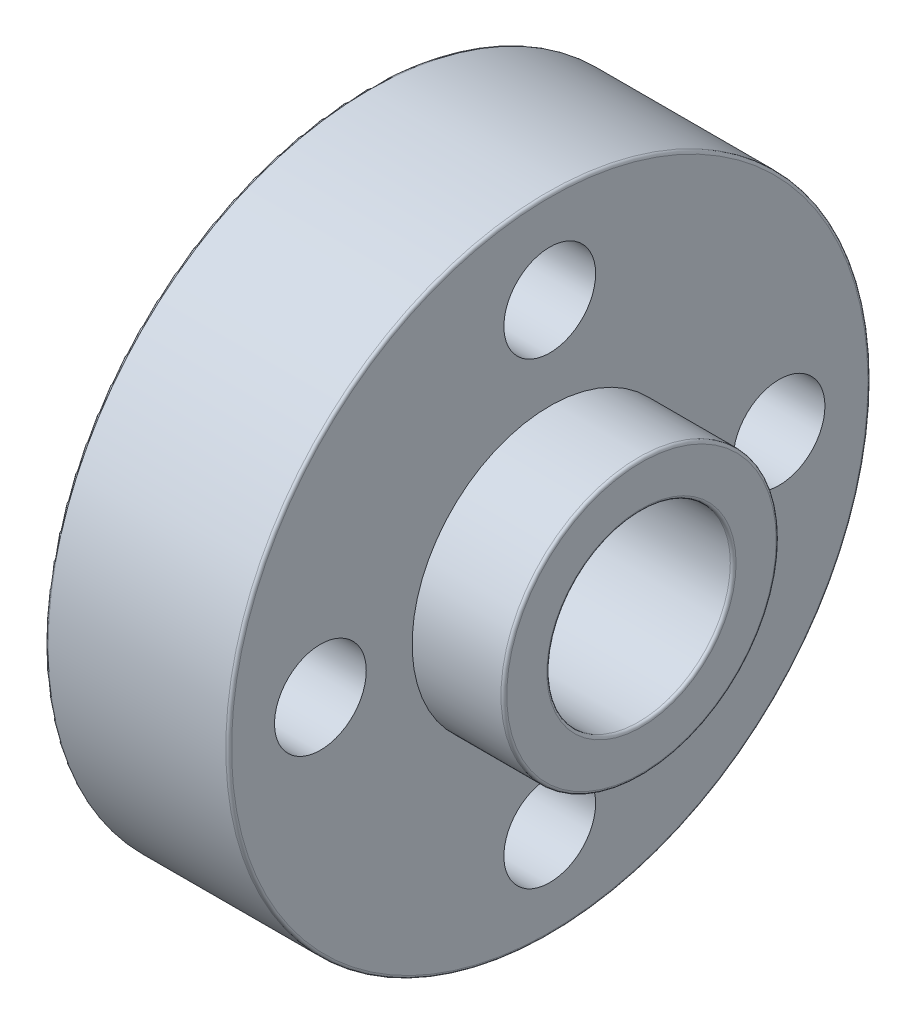
from build123d import *

# Parameters (mm, degrees)
SKETCH1_R           = 11.1125
BOSS_EXTRUDE1_DEPTH = 3.175
SKETCH2_R           = 4.7625
BOSS_EXTRUDE2_DEPTH = 3.175
SKETCH4_R           = 3.175
CUT_EXTRUDE2_DEPTH  = 17.949861725
SKETCH3_R           = 1.5875
CUT_EXTRUDE1_DEPTH  = 19.376641083
FILLET1_R           = 0.1


with BuildPart() as part:
    # Sketch1 → Boss-Extrude1 (new body)
    with BuildSketch(Plane(origin=(0, 0, 0), x_dir=(0, 0, -1), z_dir=(1, 0, 0))):
        Circle(SKETCH1_R)
    boss_extrude1 = extrude(amount=-BOSS_EXTRUDE1_DEPTH)

    # Sketch2 → Boss-Extrude2 (add)
    with BuildSketch(Plane(origin=(0, 0, 0), x_dir=(0, 0, -1), z_dir=(1, 0, 0))):
        Circle(SKETCH2_R)
    boss_extrude2 = extrude(amount=BOSS_EXTRUDE2_DEPTH)

    # Sketch4 → Cut-Extrude2 (cut, through all)
    with BuildSketch(Plane(origin=(3.175, 0, 0), x_dir=(0, 0, -1), z_dir=(1, 0, 0))):
        Circle(SKETCH4_R)
    cut_extrude2 = extrude(amount=-CUT_EXTRUDE2_DEPTH, mode=Mode.SUBTRACT)

    # Mirror1: Boss-Extrude1, Boss-Extrude2, Cut-Extrude2 across plane
    add(boss_extrude1.mirror(Plane(origin=(-3.175, 0, 0), x_dir=(0, 0, 1), z_dir=(1, 0, 0))))
    add(boss_extrude2.mirror(Plane(origin=(-3.175, 0, 0), x_dir=(0, 0, 1), z_dir=(1, 0, 0))))
    add(cut_extrude2.mirror(Plane(origin=(-3.175, 0, 0), x_dir=(0, 0, 1), z_dir=(1, 0, 0))), mode=Mode.SUBTRACT)

    # Sketch3 → Cut-Extrude1 (cut, through all)
    with BuildSketch(Plane(origin=(0, 0, 0), x_dir=(0, 0, -1), z_dir=(1, 0, 0))):
        with Locations((7.9375, 0)):
            Circle(SKETCH3_R)
        with Locations((0, -7.9375)):
            Circle(SKETCH3_R)
        with Locations((-7.9375, 0)):
            Circle(SKETCH3_R)
        with Locations((0, 7.9375)):
            Circle(SKETCH3_R)
    extrude(amount=-CUT_EXTRUDE1_DEPTH, mode=Mode.SUBTRACT)

    # Fillet1
    fillet1_edges = [part.edges().sort_by_distance(p)[0] for p in [
        (3.175, 0, 3.175),
        (3.175, 0, 4.7625),
        (0, 0, 11.1125),
        (-9.525, 0, 3.175),
        (-9.525, 0, 4.7625),
        (-6.35, 0, 11.1125),
    ]]
    fillet(fillet1_edges, radius=FILLET1_R)


solid = part.part
